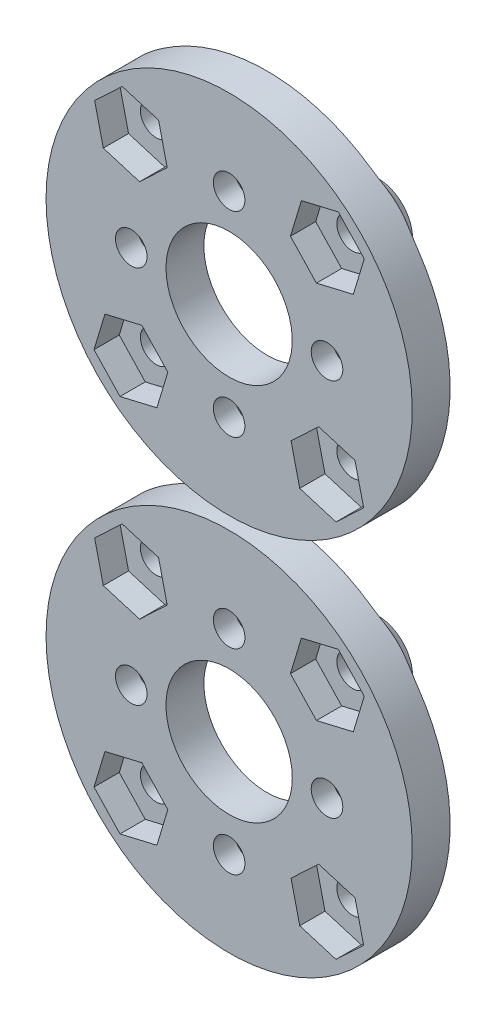
from build123d import *
from build123d.topology import SkipClean

# Parameters (mm, degrees)
SKETCH_1_R               = 14.5
SKETCH_1_R_2             = 1.25
SKETCH_1_R_3             = 5
EXTRUDE_5_DEPTH          = 3
SKETCH_1_6_R             = 5
SKETCH_1_6_R_2           = 2.3
SKETCH_1_6_R_3           = 1.25
CUT_EXTRUDE_1_DEPTH      = 1.3
SKETCH_2_R               = 1.25
CUT_EXTRUDE_2_DEPTH      = 31
EXTRUDE_START            = 1
SKETCH_3_R               = 2.75
SKETCH_3_R_2             = 1.25
EXTRUDE_6_DEPTH          = 1
FILLET_1_R               = 1.5
CUT_EXTRUDE_3_DEPTH      = 2
PATTERN_CIRCULAR_2_COUNT = 2
SKETCH_7_W               = 1
SKETCH_7_H               = 1.957068822
EXTRUDE_7_DEPTH          = 1


with BuildPart() as part:
    # 草图1 → 凸台-拉伸5 (new body)
    with BuildSketch(Plane.XY):
        Circle(SKETCH_1_R)
        with Locations((0, 7.75)):
            Circle(SKETCH_1_R_2, mode=Mode.SUBTRACT)
        with Locations((7.75, 0)):
            Circle(SKETCH_1_R_2, mode=Mode.SUBTRACT)
        with Locations((0, -7.75)):
            Circle(SKETCH_1_R_2, mode=Mode.SUBTRACT)
        with Locations((-7.75, 0)):
            Circle(SKETCH_1_R_2, mode=Mode.SUBTRACT)
        Circle(SKETCH_1_R_3, mode=Mode.SUBTRACT)
    extrude(amount=EXTRUDE_5_DEPTH)

    # 草图1<6> → 切除-拉伸1 (cut)
    # profile 1 of 8: a face of its own
    with BuildSketch(Plane.XY):
        Circle(SKETCH_1_6_R)
    # profile 2 of 8: a face of its own
    with BuildSketch(Plane.XY):
        with Locations((7.75, 0)):
            Circle(SKETCH_1_6_R_2)
        with Locations((7.75, 0)):
            Circle(SKETCH_1_6_R_3, mode=Mode.SUBTRACT)
    # profile 3 of 8: a face of its own
    with BuildSketch(Plane.XY):
        Circle(SKETCH_1_6_R)
    # profile 4 of 8: a face of its own
    with BuildSketch(Plane.XY):
        with Locations((0, 7.75)):
            Circle(SKETCH_1_6_R_2)
        with Locations((0, 7.75)):
            Circle(SKETCH_1_6_R_3, mode=Mode.SUBTRACT)
    # profile 5 of 8: a face of its own
    with BuildSketch(Plane.XY):
        Circle(SKETCH_1_6_R)
    # profile 6 of 8: a face of its own
    with BuildSketch(Plane.XY):
        with Locations((-7.75, 0)):
            Circle(SKETCH_1_6_R_2)
        with Locations((-7.75, 0)):
            Circle(SKETCH_1_6_R_3, mode=Mode.SUBTRACT)
    # profile 7 of 8: a face of its own
    with BuildSketch(Plane.XY):
        Circle(SKETCH_1_6_R)
    # profile 8 of 8: a face of its own
    with BuildSketch(Plane.XY):
        with Locations((0, -7.75)):
            Circle(SKETCH_1_6_R_2)
        with Locations((0, -7.75)):
            Circle(SKETCH_1_6_R_3, mode=Mode.SUBTRACT)
    extrude(amount=CUT_EXTRUDE_1_DEPTH, mode=Mode.SUBTRACT)

    # 草图2 → 切除-拉伸2 (cut)
    with BuildSketch(Plane.XY):
        with Locations((-7.778174593, 7.778174593)):
            Circle(SKETCH_2_R)
        with Locations((7.778174593, 7.778174593)):
            Circle(SKETCH_2_R)
        with Locations((7.778174593, -7.778174593)):
            Circle(SKETCH_2_R)
        with Locations((-7.778174593, -7.778174593)):
            Circle(SKETCH_2_R)
    extrude(amount=CUT_EXTRUDE_2_DEPTH, mode=Mode.SUBTRACT)

    # 草图3 → 凸台-拉伸6 (add)
    # profile 1 of 4: a face of its own
    with SkipClean():  # the faces are left unmerged after this step: merging them gives an invalid solid
        with BuildSketch(Plane(origin=(0, 0, 0), x_dir=(-1, 0, 0), z_dir=(0, 0, -1)).offset(EXTRUDE_START)):
            with Locations(Location((7.778174593, 7.778174593, 0), (0, 0, 180))):
                Circle(SKETCH_3_R)
            with Locations((7.778174593, 7.778174593)):
                Circle(SKETCH_3_R_2, mode=Mode.SUBTRACT)
        # profile 2 of 4: a face of its own
        with BuildSketch(Plane(origin=(0, 0, 0), x_dir=(-1, 0, 0), z_dir=(0, 0, -1)).offset(EXTRUDE_START)):
            with Locations(Location((7.778174593, -7.778174593, 0), (0, 0, 180))):
                Circle(SKETCH_3_R)
            with Locations((7.778174593, -7.778174593)):
                Circle(SKETCH_3_R_2, mode=Mode.SUBTRACT)
        # profile 3 of 4: a face of its own
        with BuildSketch(Plane(origin=(0, 0, 0), x_dir=(-1, 0, 0), z_dir=(0, 0, -1)).offset(EXTRUDE_START)):
            with Locations(Location((-7.778174593, -7.778174593, 0), (0, 0, 180))):
                Circle(SKETCH_3_R)
            with Locations((-7.778174593, -7.778174593)):
                Circle(SKETCH_3_R_2, mode=Mode.SUBTRACT)
        # profile 4 of 4: a face of its own
        with BuildSketch(Plane(origin=(0, 0, 0), x_dir=(-1, 0, 0), z_dir=(0, 0, -1)).offset(EXTRUDE_START)):
            with Locations(Location((-7.778174593, 7.778174593, 0), (0, 0, 180))):
                Circle(SKETCH_3_R)
            with Locations((-7.778174593, 7.778174593)):
                Circle(SKETCH_3_R_2, mode=Mode.SUBTRACT)
        extrude(amount=-EXTRUDE_6_DEPTH)

    # 圆角1
    # the kernel refuses this fillet: 1.5 mm, written as the material it adds along each edge
    with BuildSketch(Plane(origin=(-7.778174593, 7.778174593, 0), x_dir=(1, 0, 0), z_dir=(0, 1, 0))) as fillet_1_piece_1_section:
        with BuildLine():
            CenterArc((4.164213562, 1.5), FILLET_1_R, 199.471220634, 70.528779366)
            Line((2.75, 1), (2.721715729, 0.99))
            ThreePointArc((2.721715729, 0.99), (2.72, 0.5), (2.72, 0))
            Line((2.72, 0), (2.75, -0.03))
            Line((2.75, -0.03), (4.164213562, -0.03))
            Line((4.164213562, -0.03), (4.164213562, 0))
        make_face()
    fillet_1_piece_1 = revolve(axis=Axis((-7.778174593, 7.778174593, 0), (0, 0, -1)), mode=Mode.PRIVATE)
    fillet_1_piece_1 = fillet_1_piece_1 & Plane(origin=(0, 0, -0.258469001), x_dir=(1, 0, 0), z_dir=(0, 0, -1)) * Cylinder(14.5, 17, mode=Mode.PRIVATE)
    add(fillet_1_piece_1)
    with BuildSketch(Plane(origin=(-7.778174593, -7.778174593, 0), x_dir=(1, 0, 0), z_dir=(0, 1, 0))) as fillet_1_piece_2_section:
        with BuildLine():
            CenterArc((4.164213562, 1.5), FILLET_1_R, 199.471220634, 70.528779366)
            Line((2.75, 1), (2.721715729, 0.99))
            ThreePointArc((2.721715729, 0.99), (2.72, 0.5), (2.72, 0))
            Line((2.72, 0), (2.75, -0.03))
            Line((2.75, -0.03), (4.164213562, -0.03))
            Line((4.164213562, -0.03), (4.164213562, 0))
        make_face()
    fillet_1_piece_2 = revolve(axis=Axis((-7.778174593, -7.778174593, 0), (0, 0, -1)), mode=Mode.PRIVATE)
    fillet_1_piece_2 = fillet_1_piece_2 & Plane(origin=(0, 0, -0.258469001), x_dir=(1, 0, 0), z_dir=(0, 0, -1)) * Cylinder(14.5, 17, mode=Mode.PRIVATE)
    add(fillet_1_piece_2)
    with BuildSketch(Plane(origin=(7.778174593, -7.778174593, 0), x_dir=(1, 0, 0), z_dir=(0, 1, 0))) as fillet_1_piece_3_section:
        with BuildLine():
            CenterArc((4.164213562, 1.5), FILLET_1_R, 199.471220634, 70.528779366)
            Line((2.75, 1), (2.721715729, 0.99))
            ThreePointArc((2.721715729, 0.99), (2.72, 0.5), (2.72, 0))
            Line((2.72, 0), (2.75, -0.03))
            Line((2.75, -0.03), (4.164213562, -0.03))
            Line((4.164213562, -0.03), (4.164213562, 0))
        make_face()
    fillet_1_piece_3 = revolve(axis=Axis((7.778174593, -7.778174593, 0), (0, 0, -1)), mode=Mode.PRIVATE)
    fillet_1_piece_3 = fillet_1_piece_3 & Plane(origin=(0, 0, -0.258469001), x_dir=(1, 0, 0), z_dir=(0, 0, -1)) * Cylinder(14.5, 17, mode=Mode.PRIVATE)
    add(fillet_1_piece_3)
    with BuildSketch(Plane(origin=(7.778174593, 7.778174593, 0), x_dir=(1, 0, 0), z_dir=(0, 1, 0))) as fillet_1_piece_4_section:
        with BuildLine():
            CenterArc((4.164213562, 1.5), FILLET_1_R, 199.471220634, 70.528779366)
            Line((2.75, 1), (2.721715729, 0.99))
            ThreePointArc((2.721715729, 0.99), (2.72, 0.5), (2.72, 0))
            Line((2.72, 0), (2.75, -0.03))
            Line((2.75, -0.03), (4.164213562, -0.03))
            Line((4.164213562, -0.03), (4.164213562, 0))
        make_face()
    fillet_1_piece_4 = revolve(axis=Axis((7.778174593, 7.778174593, 0), (0, 0, -1)), mode=Mode.PRIVATE)
    fillet_1_piece_4 = fillet_1_piece_4 & Plane(origin=(0, 0, -0.258469001), x_dir=(1, 0, 0), z_dir=(0, 0, -1)) * Cylinder(14.5, 17, mode=Mode.PRIVATE)
    add(fillet_1_piece_4)

    # 草图4 → 切除-拉伸3 (cut)
    with BuildSketch(Plane.XY.offset(3)):
        Polygon((6.911384071, 4.903803788), (9.834057469, 5.590326579), (10.700847991, 8.464697384), (8.644965115, 10.652545398), (5.722291717, 9.966022607), (4.855501195, 7.091651802), align=None)
        Polygon((-8.464697384, 10.700847991), (-10.652545398, 8.644965115), (-9.966022607, 5.722291717), (-7.091651802, 4.855501195), (-4.903803788, 6.911384071), (-5.590326579, 9.834057469), align=None)
        Polygon((4.903803788, -6.911384071), (5.590326579, -9.834057469), (8.464697384, -10.700847991), (10.652545398, -8.644965115), (9.966022607, -5.722291717), (7.091651802, -4.855501195), align=None)
        Polygon((-6.911384071, -4.903803788), (-9.834057469, -5.590326579), (-10.700847991, -8.464697384), (-8.644965115, -10.652545398), (-5.722291717, -9.966022607), (-4.855501195, -7.091651802), align=None)
    extrude(amount=-CUT_EXTRUDE_3_DEPTH, mode=Mode.SUBTRACT)


with BuildPart() as pattern_circular_2_1:
    # 阵列(圆周)2: pattern copy
    add(part.part.rotate(Axis((0, 15, 0), (0, 0, 1)), 1 * 360 / PATTERN_CIRCULAR_2_COUNT))


with BuildPart() as part_1:
    add(part.part)

    add(pattern_circular_2_1.part)  # 凸台-拉伸7 merges 阵列(圆周)2_1
    # 草图7 → 凸台-拉伸7 (add)
    with BuildSketch(Plane.XY):
        with Locations((0, 15)):
            Rectangle(SKETCH_7_W, SKETCH_7_H)
    extrude(amount=EXTRUDE_7_DEPTH)


solid = part_1.part
